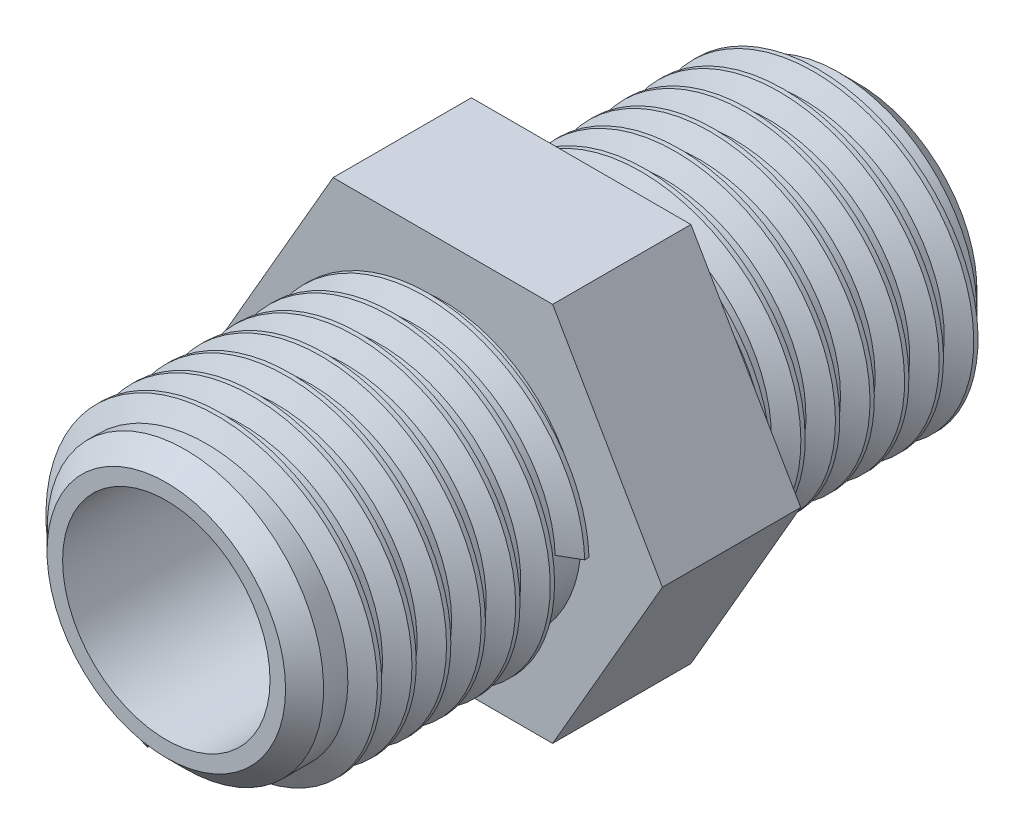
from build123d import *

# Parameters (mm, degrees)
BOSS_EXTRUDE1_DEPTH = 4
SKETCH2_R           = 4
BOSS_EXTRUDE2_DEPTH = 8
BOSS_EXTRUDE3_START = 8
SKETCH3_R           = 4
BOSS_EXTRUDE3_DEPTH = 8
SKETCH4_R           = 2.5
CUT_EXTRUDE1_DEPTH  = 22.692932797
SKETCH5_R           = 3
CUT_EXTRUDE2_DEPTH  = 6
CUT_EXTRUDE3_START  = -6
SKETCH6_R           = 3
CUT_EXTRUDE3_DEPTH  = 6
CHAMFER1_SIZE       = 0.55
THREAD1_PITCH       = 1
THREAD2_PITCH       = 1


with BuildPart() as part:
    # Sketch1 → Boss-Extrude1 (new body)
    with BuildSketch(Plane.XY):
        Polygon((6.350852961, 0), (3.175426481, 5.5), (-3.175426481, 5.5), (-6.350852961, 0), (-3.175426481, -5.5), (3.175426481, -5.5), align=None)
    extrude(amount=BOSS_EXTRUDE1_DEPTH)

    # Sketch2 → Boss-Extrude2 (add)
    with BuildSketch(Plane.XY.offset(4)):
        Circle(SKETCH2_R)
    extrude(amount=BOSS_EXTRUDE2_DEPTH)

    # Sketch3 → Boss-Extrude3 (add)
    with BuildSketch(Plane(origin=(0, 0, 0), x_dir=(-1, 0, 0), z_dir=(0, 0, -1)).offset(BOSS_EXTRUDE3_START)):
        with Locations(Location((0, 0, 0), (0, 0, 180))):
            Circle(SKETCH3_R)
    extrude(amount=-BOSS_EXTRUDE3_DEPTH)

    # Sketch4 → Cut-Extrude1 (cut, through all)
    with BuildSketch(Plane(origin=(0, 0, -8), x_dir=(-1, 0, 0), z_dir=(0, 0, -1))):
        Circle(SKETCH4_R)
    extrude(amount=-CUT_EXTRUDE1_DEPTH, mode=Mode.SUBTRACT)

    # Sketch5 → Cut-Extrude2 (cut)
    with BuildSketch(Plane(origin=(0, 0, -8), x_dir=(-1, 0, 0), z_dir=(0, 0, -1))):
        Circle(SKETCH5_R)
    extrude(amount=-CUT_EXTRUDE2_DEPTH, mode=Mode.SUBTRACT)

    # Sketch6 → Cut-Extrude3 (cut)
    with BuildSketch(Plane.XY.offset(12).offset(CUT_EXTRUDE3_START)):
        with Locations(Location((0, 0, 0), (0, 0, 180))):
            Circle(SKETCH6_R)
    extrude(amount=CUT_EXTRUDE3_DEPTH, mode=Mode.SUBTRACT)

    # Chamfer1
    chamfer1_edges = [part.edges().sort_by_distance(p)[0] for p in [
        (-4, 0, 12),
        (-4, 0, -8),
    ]]
    chamfer(chamfer1_edges, length=CHAMFER1_SIZE)

    # Thread1: the profile of Thread Profile1 profile screwed along a right-hand helix of 6.7 turns, 8 arcs to a turn; built about Z, then put on its axis
    thread1_z = Axis((0, 0, 0), (0, 0, 1))
    thread1_corners = [(3.9997, 0, -0.000173205), (4.541265875, 0, 0.312499999), (4.541265875, 0, 0.437499999), (3.9997, 0, 0.750173202)]
    with BuildLine(mode=Mode.PRIVATE) as thread1_profile:
        Line(thread1_corners[0], thread1_corners[1])
        Line(thread1_corners[1], thread1_corners[2])
        Line(thread1_corners[2], thread1_corners[3])
        Line(thread1_corners[3], thread1_corners[0])
    thread1_cap = Face(thread1_profile.wire())
    thread1_turn_angles = [0, 22.5, 45, 67.5, 90, 112.5, 135, 157.5, 180, 202.5, 225, 247.5, 270, 292.5, 315, 337.5, 360]
    thread1_turn_weights = [1, 0.9238795325112867, 1, 0.9238795325112867, 1, 0.9238795325112867, 1, 0.9238795325112867, 1, 0.9238795325112867, 1, 0.9238795325112867, 1, 0.9238795325112867, 1, 0.9238795325112867, 1]
    thread1_turn_rails = [Edge.make_bspline([Vector(p[0], p[1], 0).rotate(thread1_z, thread1_turn_angles[k]) / thread1_turn_weights[k] + Vector(0, 0, p[2] + THREAD1_PITCH * thread1_turn_angles[k] / 360) for k in range(17)], [0, 0, 0, 1, 1, 2, 2, 3, 3, 4, 4, 5, 5, 6, 6, 7, 7, 8, 8, 8], 2, thread1_turn_weights) for p in thread1_corners]
    thread1_turn_sides = [Face.make_surface_from_curves(thread1_turn_rails[p[0]], thread1_turn_rails[p[1]]) for p in [(0, 1), (1, 2), (2, 3), (3, 0)]]
    thread1_last_angles = [2160, 2182.5, 2205, 2227.5, 2250, 2272.5, 2295, 2317.5, 2340, 2362.5, 2385, 2398.5, 2412]
    thread1_last_weights = [1, 0.9238795325112867, 1, 0.9238795325112867, 1, 0.9238795325112867, 1, 0.9238795325112867, 1, 0.9238795325112867, 1, 0.9723699203976766, 1]
    thread1_last_rails = [Edge.make_bspline([Vector(p[0], p[1], 0).rotate(thread1_z, thread1_last_angles[k]) / thread1_last_weights[k] + Vector(0, 0, p[2] + THREAD1_PITCH * thread1_last_angles[k] / 360) for k in range(13)], [0, 0, 0, 1, 1, 2, 2, 3, 3, 4, 4, 5, 5, 6, 6, 6], 2, thread1_last_weights) for p in thread1_corners]
    thread1_last_sides = [Face.make_surface_from_curves(thread1_last_rails[p[0]], thread1_last_rails[p[1]]) for p in [(0, 1), (1, 2), (2, 3), (3, 0)]]
    thread1 = Plane(origin=(0, 0, 4), x_dir=(1, 0, 0), z_dir=(0, 0, 1)) * Solid(Shell([*[p.moved(Location((0, 0, THREAD1_PITCH * i))) for i in range(6) for p in thread1_turn_sides], *thread1_last_sides, thread1_cap, thread1_cap.rotate(thread1_z, 2412).moved(Location((0, 0, THREAD1_PITCH * 2412 / 360)))]))
    add(thread1)

    # Thread2: the profile of Thread Profile2 profile screwed along a right-hand helix of 6.7 turns, 8 arcs to a turn; built about Z, then put on its axis
    thread2_z = Axis((0, 0, 0), (0, 0, 1))
    thread2_corners = [(3.9997, 0, -0.000173205), (4.541265875, 0, 0.312499999), (4.541265875, 0, 0.437499999), (3.9997, 0, 0.750173202)]
    with BuildLine(mode=Mode.PRIVATE) as thread2_profile:
        Line(thread2_corners[0], thread2_corners[1])
        Line(thread2_corners[1], thread2_corners[2])
        Line(thread2_corners[2], thread2_corners[3])
        Line(thread2_corners[3], thread2_corners[0])
    thread2_cap = Face(thread2_profile.wire())
    thread2_turn_angles = [0, 22.5, 45, 67.5, 90, 112.5, 135, 157.5, 180, 202.5, 225, 247.5, 270, 292.5, 315, 337.5, 360]
    thread2_turn_weights = [1, 0.9238795325112867, 1, 0.9238795325112867, 1, 0.9238795325112867, 1, 0.9238795325112867, 1, 0.9238795325112867, 1, 0.9238795325112867, 1, 0.9238795325112867, 1, 0.9238795325112867, 1]
    thread2_turn_rails = [Edge.make_bspline([Vector(p[0], p[1], 0).rotate(thread2_z, thread2_turn_angles[k]) / thread2_turn_weights[k] + Vector(0, 0, p[2] + THREAD2_PITCH * thread2_turn_angles[k] / 360) for k in range(17)], [0, 0, 0, 1, 1, 2, 2, 3, 3, 4, 4, 5, 5, 6, 6, 7, 7, 8, 8, 8], 2, thread2_turn_weights) for p in thread2_corners]
    thread2_turn_sides = [Face.make_surface_from_curves(thread2_turn_rails[p[0]], thread2_turn_rails[p[1]]) for p in [(0, 1), (1, 2), (2, 3), (3, 0)]]
    thread2_last_angles = [2160, 2182.5, 2205, 2227.5, 2250, 2272.5, 2295, 2317.5, 2340, 2362.5, 2385, 2398.5, 2412]
    thread2_last_weights = [1, 0.9238795325112867, 1, 0.9238795325112867, 1, 0.9238795325112867, 1, 0.9238795325112867, 1, 0.9238795325112867, 1, 0.9723699203976766, 1]
    thread2_last_rails = [Edge.make_bspline([Vector(p[0], p[1], 0).rotate(thread2_z, thread2_last_angles[k]) / thread2_last_weights[k] + Vector(0, 0, p[2] + THREAD2_PITCH * thread2_last_angles[k] / 360) for k in range(13)], [0, 0, 0, 1, 1, 2, 2, 3, 3, 4, 4, 5, 5, 6, 6, 6], 2, thread2_last_weights) for p in thread2_corners]
    thread2_last_sides = [Face.make_surface_from_curves(thread2_last_rails[p[0]], thread2_last_rails[p[1]]) for p in [(0, 1), (1, 2), (2, 3), (3, 0)]]
    thread2 = Plane(origin=(0, 0, 0), x_dir=(-1, 0, 0), z_dir=(0, 0, -1)) * Solid(Shell([*[p.moved(Location((0, 0, THREAD2_PITCH * i))) for i in range(6) for p in thread2_turn_sides], *thread2_last_sides, thread2_cap, thread2_cap.rotate(thread2_z, 2412).moved(Location((0, 0, THREAD2_PITCH * 2412 / 360)))]))
    add(thread2)


solid = part.part
